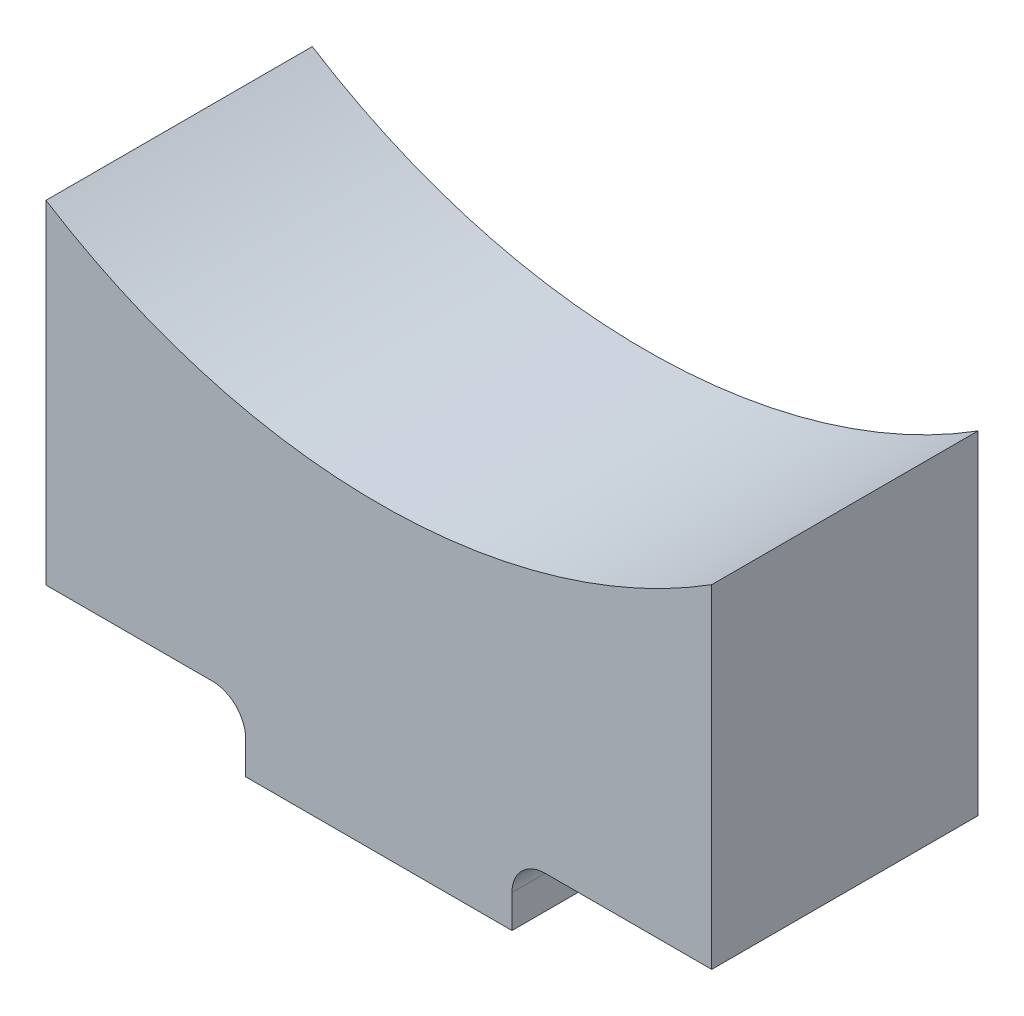
from build123d import *

# Parameters (mm, degrees)
BOSS_EXTRUDE1_DEPTH = 4


with BuildPart() as part:
    # Sketch1 → Boss-Extrude1 (new, symmetric)
    with BuildSketch(Plane.XY):
        with BuildLine():
            Line((10, 3.992849301), (10, -6.01853916))
            Line((10, -6.01853916), (5, -6.01853916))
            ThreePointArc((5, -6.01853916), (4.292893219, -6.311432379), (4, -7.01853916))
            Line((4, -7.01853916), (4, -8.007150699))
            Line((4, -8.007150699), (-4, -8.007150699))
            Line((-4, -8.007150699), (-4, -7.01853916))
            ThreePointArc((-4, -7.01853916), (-4.292893219, -6.311432379), (-5, -6.01853916))
            Line((-5, -6.01853916), (-10, -6.01853916))
            Line((-10, -6.01853916), (-10, 3.992849301))
            ThreePointArc((-10, 3.992849301), (0, 1.100511346), (10, 3.992849301))
        make_face()
    extrude(amount=BOSS_EXTRUDE1_DEPTH, both=True)


solid = part.part
